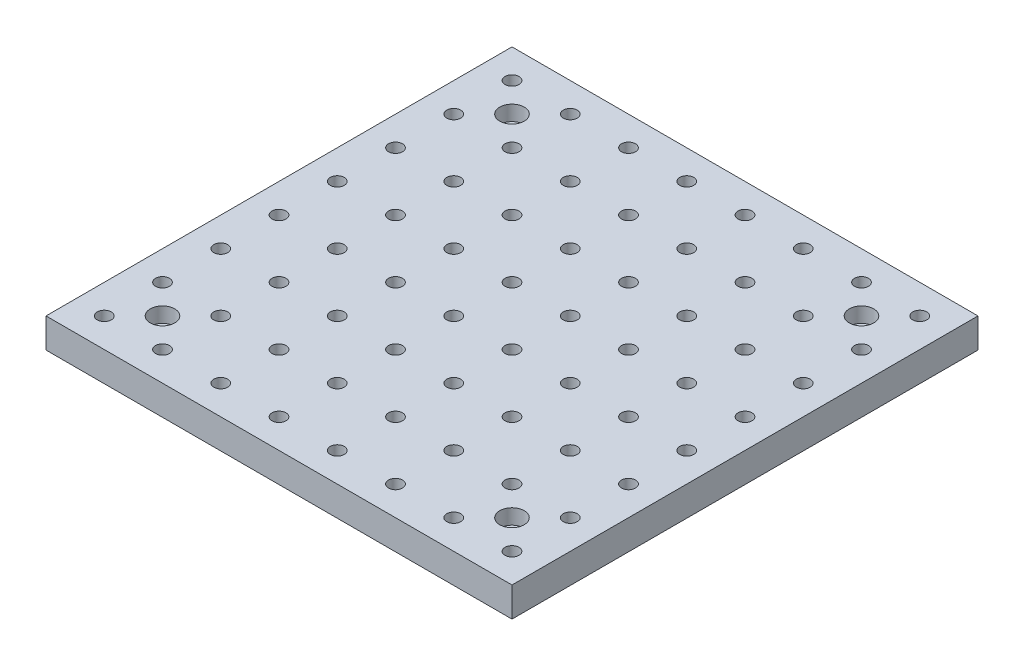
from build123d import *

# Parameters (mm, degrees)
SKETCH1_W                                  = 200
SKETCH1_H                                  = 200
SKETCH1_R                                  = 3
BOSS_EXTRUDE1_DEPTH                        = 12.7
SKETCH2_R                                  = 5.25
CUT_EXTRUDE1_DEPTH                         = 6.5
SKETCH3_R                                  = 1.65
CUT_EXTRUDE2_DEPTH                         = 142.570653739
MIRROR1_AT_THE_SECOND_PLANE_COPY_1_SKETC_R = 1.65
MIRROR1_AT_THE_SECOND_PLANE_COPY_1_DEPTH   = 142.570653739


with BuildPart() as part:
    # Sketch1 → Boss-Extrude1 (new body)
    with BuildSketch(Plane(origin=(0, 0, 0), x_dir=(1, 0, 0), z_dir=(0, 1, 0))):
        Rectangle(SKETCH1_W, SKETCH1_H)
        with Locations((-87.5, 87.5)):
            Circle(SKETCH1_R, mode=Mode.SUBTRACT)
        with Locations((-62.5, 87.5)):
            Circle(SKETCH1_R, mode=Mode.SUBTRACT)
        with Locations((-37.5, 87.5)):
            Circle(SKETCH1_R, mode=Mode.SUBTRACT)
        with Locations((-12.5, 87.5)):
            Circle(SKETCH1_R, mode=Mode.SUBTRACT)
        with Locations((12.5, 87.5)):
            Circle(SKETCH1_R, mode=Mode.SUBTRACT)
        with Locations((37.5, 87.5)):
            Circle(SKETCH1_R, mode=Mode.SUBTRACT)
        with Locations((62.5, 87.5)):
            Circle(SKETCH1_R, mode=Mode.SUBTRACT)
        with Locations((87.5, 87.5)):
            Circle(SKETCH1_R, mode=Mode.SUBTRACT)
        with Locations((-62.5, 62.5)):
            Circle(SKETCH1_R, mode=Mode.SUBTRACT)
        with Locations((-37.5, 62.5)):
            Circle(SKETCH1_R, mode=Mode.SUBTRACT)
        with Locations((-12.5, 62.5)):
            Circle(SKETCH1_R, mode=Mode.SUBTRACT)
        with Locations((12.5, 62.5)):
            Circle(SKETCH1_R, mode=Mode.SUBTRACT)
        with Locations((37.5, 62.5)):
            Circle(SKETCH1_R, mode=Mode.SUBTRACT)
        with Locations((62.5, 62.5)):
            Circle(SKETCH1_R, mode=Mode.SUBTRACT)
        with Locations((87.5, 62.5)):
            Circle(SKETCH1_R, mode=Mode.SUBTRACT)
        with Locations((-62.5, 37.5)):
            Circle(SKETCH1_R, mode=Mode.SUBTRACT)
        with Locations((-37.5, 37.5)):
            Circle(SKETCH1_R, mode=Mode.SUBTRACT)
        with Locations((-12.5, 37.5)):
            Circle(SKETCH1_R, mode=Mode.SUBTRACT)
        with Locations((12.5, 37.5)):
            Circle(SKETCH1_R, mode=Mode.SUBTRACT)
        with Locations((37.5, 37.5)):
            Circle(SKETCH1_R, mode=Mode.SUBTRACT)
        with Locations((62.5, 37.5)):
            Circle(SKETCH1_R, mode=Mode.SUBTRACT)
        with Locations((87.5, 37.5)):
            Circle(SKETCH1_R, mode=Mode.SUBTRACT)
        with Locations((-62.5, 12.5)):
            Circle(SKETCH1_R, mode=Mode.SUBTRACT)
        with Locations((-37.5, 12.5)):
            Circle(SKETCH1_R, mode=Mode.SUBTRACT)
        with Locations((-12.5, 12.5)):
            Circle(SKETCH1_R, mode=Mode.SUBTRACT)
        with Locations((12.5, 12.5)):
            Circle(SKETCH1_R, mode=Mode.SUBTRACT)
        with Locations((37.5, 12.5)):
            Circle(SKETCH1_R, mode=Mode.SUBTRACT)
        with Locations((62.5, 12.5)):
            Circle(SKETCH1_R, mode=Mode.SUBTRACT)
        with Locations((87.5, 12.5)):
            Circle(SKETCH1_R, mode=Mode.SUBTRACT)
        with Locations((-62.5, -12.5)):
            Circle(SKETCH1_R, mode=Mode.SUBTRACT)
        with Locations((-37.5, -12.5)):
            Circle(SKETCH1_R, mode=Mode.SUBTRACT)
        with Locations((-12.5, -12.5)):
            Circle(SKETCH1_R, mode=Mode.SUBTRACT)
        with Locations((12.5, -12.5)):
            Circle(SKETCH1_R, mode=Mode.SUBTRACT)
        with Locations((37.5, -12.5)):
            Circle(SKETCH1_R, mode=Mode.SUBTRACT)
        with Locations((62.5, -12.5)):
            Circle(SKETCH1_R, mode=Mode.SUBTRACT)
        with Locations((87.5, -12.5)):
            Circle(SKETCH1_R, mode=Mode.SUBTRACT)
        with Locations((-62.5, -37.5)):
            Circle(SKETCH1_R, mode=Mode.SUBTRACT)
        with Locations((-37.5, -37.5)):
            Circle(SKETCH1_R, mode=Mode.SUBTRACT)
        with Locations((-12.5, -37.5)):
            Circle(SKETCH1_R, mode=Mode.SUBTRACT)
        with Locations((12.5, -37.5)):
            Circle(SKETCH1_R, mode=Mode.SUBTRACT)
        with Locations((37.5, -37.5)):
            Circle(SKETCH1_R, mode=Mode.SUBTRACT)
        with Locations((62.5, -37.5)):
            Circle(SKETCH1_R, mode=Mode.SUBTRACT)
        with Locations((87.5, -37.5)):
            Circle(SKETCH1_R, mode=Mode.SUBTRACT)
        with Locations((-62.5, -62.5)):
            Circle(SKETCH1_R, mode=Mode.SUBTRACT)
        with Locations((-37.5, -62.5)):
            Circle(SKETCH1_R, mode=Mode.SUBTRACT)
        with Locations((-12.5, -62.5)):
            Circle(SKETCH1_R, mode=Mode.SUBTRACT)
        with Locations((12.5, -62.5)):
            Circle(SKETCH1_R, mode=Mode.SUBTRACT)
        with Locations((37.5, -62.5)):
            Circle(SKETCH1_R, mode=Mode.SUBTRACT)
        with Locations((62.5, -62.5)):
            Circle(SKETCH1_R, mode=Mode.SUBTRACT)
        with Locations((87.5, -62.5)):
            Circle(SKETCH1_R, mode=Mode.SUBTRACT)
        with Locations((-62.5, -87.5)):
            Circle(SKETCH1_R, mode=Mode.SUBTRACT)
        with Locations((-37.5, -87.5)):
            Circle(SKETCH1_R, mode=Mode.SUBTRACT)
        with Locations((-12.5, -87.5)):
            Circle(SKETCH1_R, mode=Mode.SUBTRACT)
        with Locations((12.5, -87.5)):
            Circle(SKETCH1_R, mode=Mode.SUBTRACT)
        with Locations((37.5, -87.5)):
            Circle(SKETCH1_R, mode=Mode.SUBTRACT)
        with Locations((62.5, -87.5)):
            Circle(SKETCH1_R, mode=Mode.SUBTRACT)
        with Locations((87.5, -87.5)):
            Circle(SKETCH1_R, mode=Mode.SUBTRACT)
        with Locations((-87.5, 62.5)):
            Circle(SKETCH1_R, mode=Mode.SUBTRACT)
        with Locations((-87.5, 37.5)):
            Circle(SKETCH1_R, mode=Mode.SUBTRACT)
        with Locations((-87.5, 12.5)):
            Circle(SKETCH1_R, mode=Mode.SUBTRACT)
        with Locations((-87.5, -12.5)):
            Circle(SKETCH1_R, mode=Mode.SUBTRACT)
        with Locations((-87.5, -37.5)):
            Circle(SKETCH1_R, mode=Mode.SUBTRACT)
        with Locations((-87.5, -62.5)):
            Circle(SKETCH1_R, mode=Mode.SUBTRACT)
        with Locations((-87.5, -87.5)):
            Circle(SKETCH1_R, mode=Mode.SUBTRACT)
    extrude(amount=-BOSS_EXTRUDE1_DEPTH)

    # Sketch2 → Cut-Extrude1 (cut)
    with BuildSketch(Plane(origin=(0, 0, 0), x_dir=(1, 0, 0), z_dir=(0, 1, 0))):
        with Locations((-75, -75)):
            Circle(SKETCH2_R)
        with Locations((75, -75)):
            Circle(SKETCH2_R)
        with Locations((75, 75)):
            Circle(SKETCH2_R)
        with Locations((-75, 75)):
            Circle(SKETCH2_R)
    extrude(amount=-CUT_EXTRUDE1_DEPTH, mode=Mode.SUBTRACT)

    # Sketch3 → Cut-Extrude2 (cut, symmetric)
    with BuildSketch(Plane(origin=(0, -6.5, 0), x_dir=(1, 0, 0), z_dir=(0, 1, 0))):
        with Locations((-75, -75)):
            Circle(SKETCH3_R)
    cut_extrude2 = extrude(amount=CUT_EXTRUDE2_DEPTH, both=True, mode=Mode.SUBTRACT)

    # Mirror1: Cut-Extrude2 across plane
    add(cut_extrude2.mirror(Plane(origin=(0, 0, 0), x_dir=(0, 0, 1), z_dir=(1, 0, 0))), mode=Mode.SUBTRACT)

    # Mirror1 at the second plane: Cut-Extrude2 across plane
    add(cut_extrude2.mirror(Plane.XY), mode=Mode.SUBTRACT)

    # Mirror1 at the second plane copy 1 sketc → Mirror1 at the second plane copy 1 (cut, symmetric)
    with BuildSketch(Plane(origin=(0, -6.5, 0), x_dir=(-1, 0, 0), z_dir=(0, 1, 0))):
        with Locations((-75, -75)):
            Circle(MIRROR1_AT_THE_SECOND_PLANE_COPY_1_SKETC_R)
    extrude(amount=MIRROR1_AT_THE_SECOND_PLANE_COPY_1_DEPTH, both=True, mode=Mode.SUBTRACT)


solid = part.part
